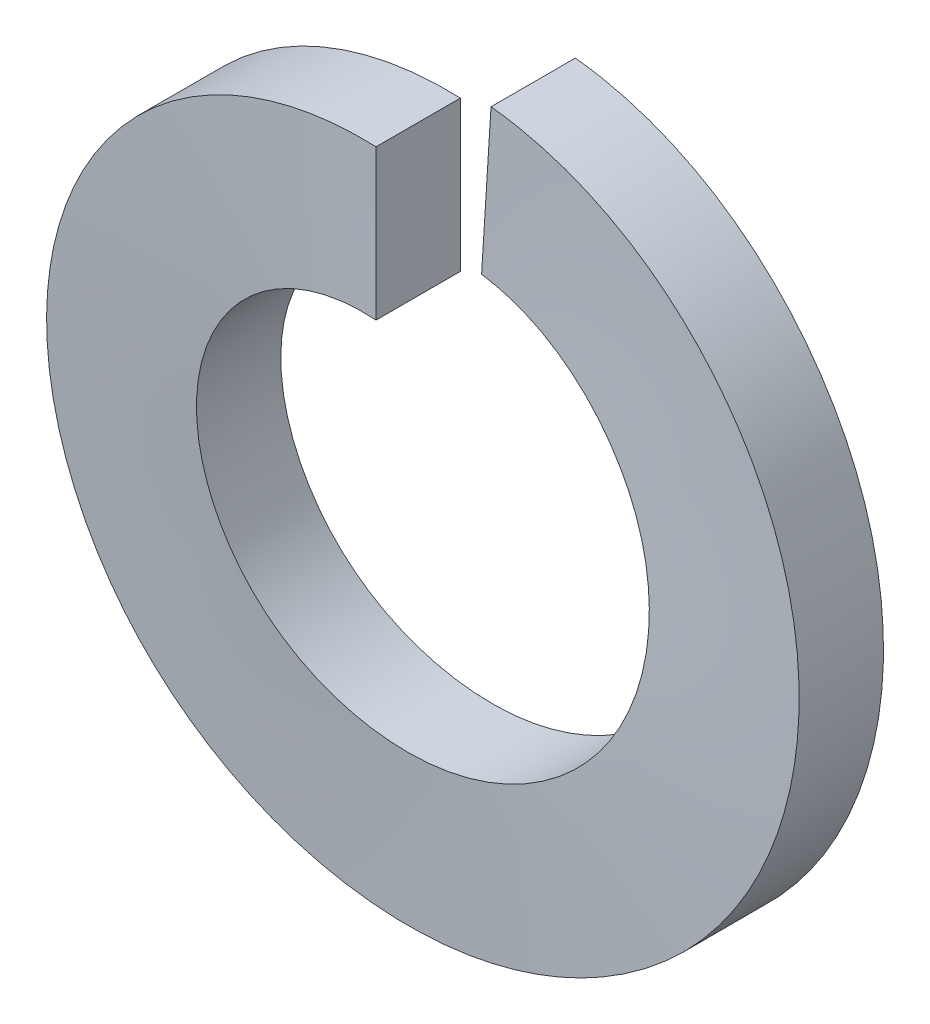
from build123d import *

# Parameters (mm, degrees)
SWEEP1_PITCH = 0.705555556


with BuildPart() as part:
    # Sweep1: the profile of Sketch2 screwed along a left-hand helix of 0.99 turns, 6 arcs to a turn; built about Z, then put on its axis
    sweep1_z = Axis((0, 0, 0), (0, 0, 1))
    sweep1_corners = [(2.6543, 0, 0), (2.6543, 0, -0.635), (1.524, 0, -0.635), (1.524, 0, 0)]
    with BuildLine(mode=Mode.PRIVATE) as sweep1_profile:
        Line(sweep1_corners[0], sweep1_corners[1])
        Line(sweep1_corners[1], sweep1_corners[2])
        Line(sweep1_corners[2], sweep1_corners[3])
        Line(sweep1_corners[3], sweep1_corners[0])
    sweep1_cap = Face(sweep1_profile.wire())
    sweep1_turn_angles = [0, -30, -60, -90, -120, -150, -180, -210, -240, -270, -300, -328.2, -356.4]
    sweep1_turn_weights = [1, 0.8660254037844387, 1, 0.8660254037844387, 1, 0.8660254037844387, 1, 0.8660254037844387, 1, 0.8660254037844387, 1, 0.8813034520649883, 1]
    sweep1_turn_rails = [Edge.make_bspline([Vector(p[0], p[1], 0).rotate(sweep1_z, sweep1_turn_angles[k]) / sweep1_turn_weights[k] + Vector(0, 0, p[2] + -SWEEP1_PITCH * sweep1_turn_angles[k] / 360) for k in range(13)], [0, 0, 0, 1, 1, 2, 2, 3, 3, 4, 4, 5, 5, 6, 6, 6], 2, sweep1_turn_weights) for p in sweep1_corners]
    sweep1_turn_sides = [Face.make_surface_from_curves(sweep1_turn_rails[p[0]], sweep1_turn_rails[p[1]]) for p in [(0, 1), (1, 2), (2, 3), (3, 0)]]
    sweep1 = Plane(origin=(0, 0, 0), x_dir=(0, 1, 0), z_dir=(0, 0, -1)) * Solid(Shell([*sweep1_turn_sides, sweep1_cap, sweep1_cap.rotate(sweep1_z, -356.4).moved(Location((0, 0, -SWEEP1_PITCH * -356.4 / 360)))]))
    add(sweep1)


solid = part.part
